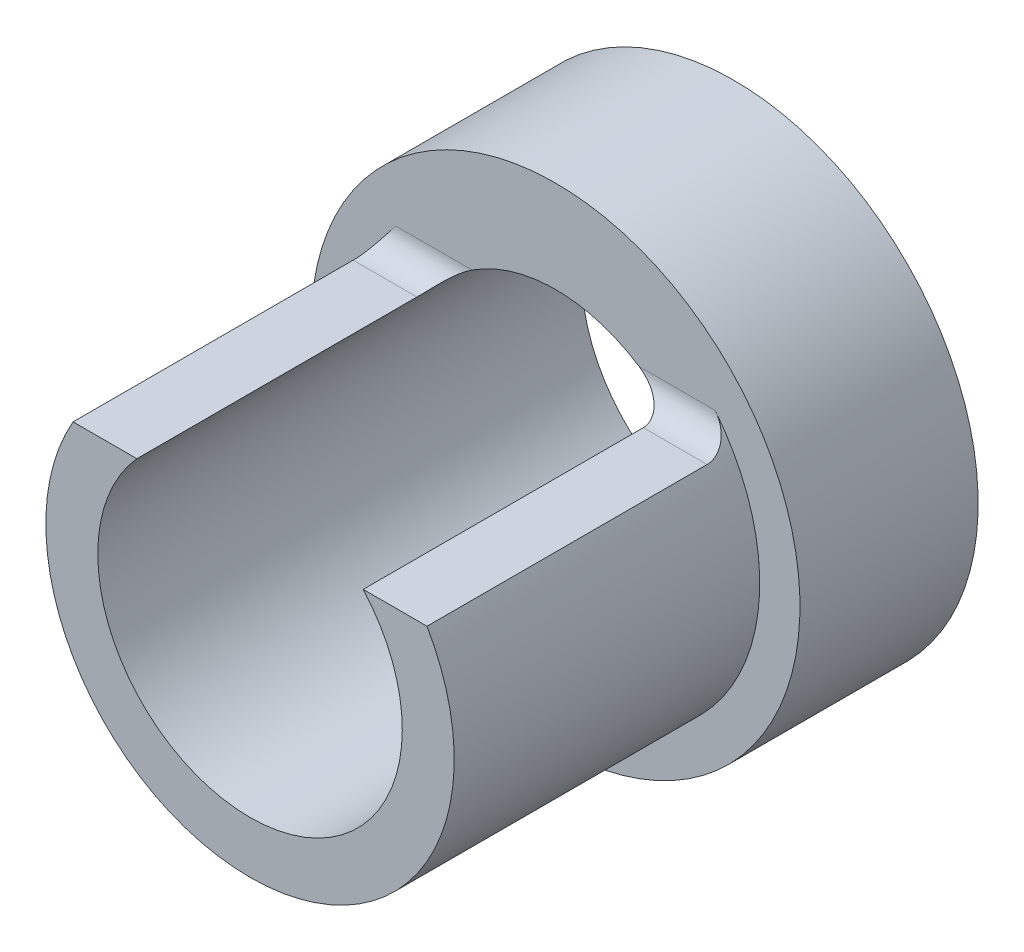
from build123d import *
from build123d.topology import SkipClean

# Parameters (mm, degrees)
BOSS_EXTRUDE1_DEPTH = 3
BOSS_EXTRUDE2_START = 1.75
SKETCH2_R           = 2.4
SKETCH2_R_2         = 1.495
BOSS_EXTRUDE2_DEPTH = 1.75
FILLET1_R           = 0.25


with BuildPart() as part:
    # Sketch1 → Boss-Extrude1 (new body)
    with BuildSketch(Plane.XY):
        with BuildLine():
            Line((-1.737821913, 1), (-1.111316787, 1))
            ThreePointArc((-1.111316787, 1), (0, -1.495), (1.111316787, 1))
            Line((1.111316787, 1), (1.737821913, 1))
            ThreePointArc((1.737821913, 1), (0, -2.005), (-1.737821913, 1))
        make_face()
    extrude(amount=BOSS_EXTRUDE1_DEPTH)

    # Sketch2 → Boss-Extrude2 (add)
    with SkipClean():  # the faces are left unmerged after this step: merging them gives an invalid solid
        with BuildSketch(Plane(origin=(0, 0, 0), x_dir=(-1, 0, 0), z_dir=(0, 0, -1)).offset(BOSS_EXTRUDE2_START)):
            Circle(SKETCH2_R)
            Circle(SKETCH2_R_2, mode=Mode.SUBTRACT)
        extrude(amount=-BOSS_EXTRUDE2_DEPTH)

    # Fillet1
    # the kernel refuses this fillet: 0.25 mm, written as the material it adds along each edge
    with BuildSketch(Plane(origin=(-2.362821913, 1, 0), x_dir=(0, 0, 1), z_dir=(1, 0, 0))) as fillet1_piece_1_section:
        with BuildLine():
            CenterArc((FILLET1_R, -FILLET1_R), FILLET1_R, 90, 90)
            Line((0, -FILLET1_R), (0, 0))
            Line((0, 0), (FILLET1_R, 0))
        make_face()
    fillet1_piece_1 = extrude(amount=1.876505126, mode=Mode.PRIVATE)
    fillet1_piece_1 = fillet1_piece_1 & Plane(origin=(0, 0, 0.055527153), x_dir=(0.8667440960723748, 0.49875311720698257, 0), z_dir=(0, 0, -1)) * Cylinder(2.005, 5, mode=Mode.PRIVATE)
    fillet1_piece_1 = fillet1_piece_1 - Plane(origin=(0, 0, 0.055527153), x_dir=(-0.7433557100464799, 0.6688963210702342, 0), z_dir=(0, 0, -1)) * Cylinder(1.495, 5, mode=Mode.PRIVATE)
    add(fillet1_piece_1)
    with BuildSketch(Plane(origin=(0.486316787, 1, 0), x_dir=(0, 0, 1), z_dir=(1, 0, 0))) as fillet1_piece_2_section:
        with BuildLine():
            CenterArc((FILLET1_R, -FILLET1_R), FILLET1_R, 90, 90)
            Line((0, -FILLET1_R), (0, 0))
            Line((0, 0), (FILLET1_R, 0))
        make_face()
    fillet1_piece_2 = extrude(amount=1.876505126, mode=Mode.PRIVATE)
    fillet1_piece_2 = fillet1_piece_2 & Plane(origin=(0, 0, 0.055527144), x_dir=(0.8667440960723748, 0.49875311720698257, 0), z_dir=(0, 0, -1)) * Cylinder(2.005, 5, mode=Mode.PRIVATE)
    fillet1_piece_2 = fillet1_piece_2 - Plane(origin=(0, 0, 0.055527144), x_dir=(-0.7433557100464799, 0.6688963210702342, 0), z_dir=(0, 0, -1)) * Cylinder(1.495, 5, mode=Mode.PRIVATE)
    add(fillet1_piece_2)


solid = part.part
